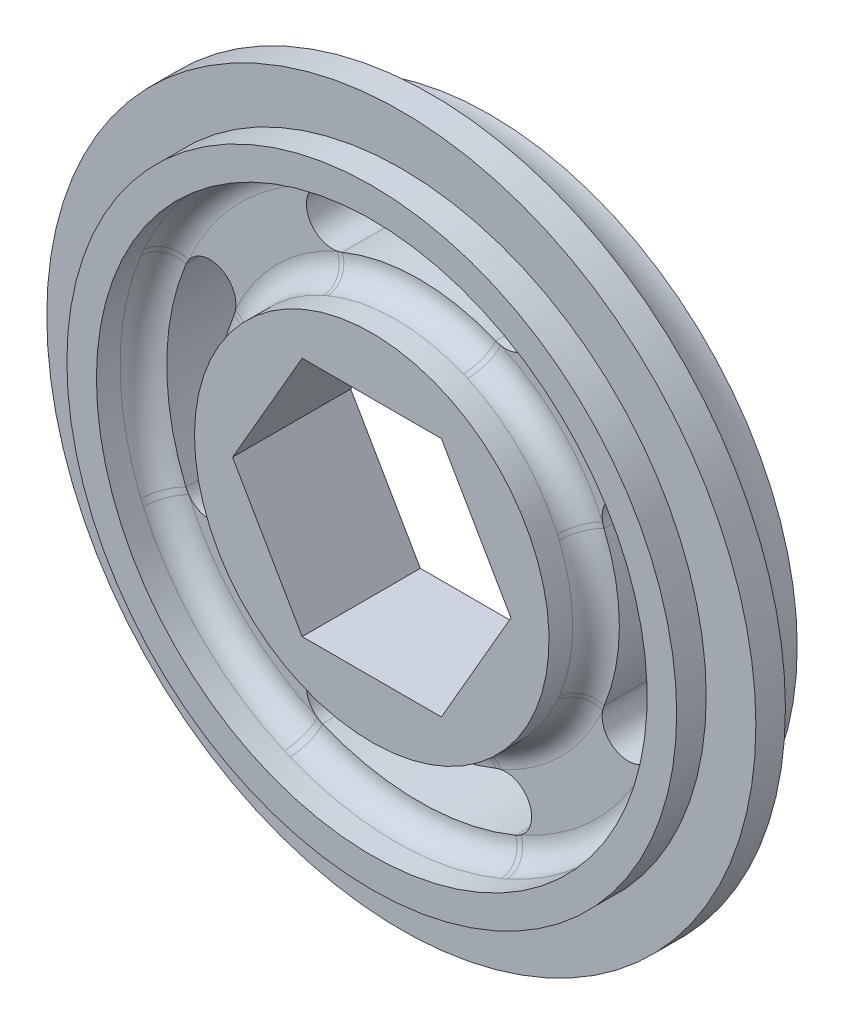
from build123d import *

# Parameters (mm, degrees)
SKETCH1_R                         = 19.05
HEX_AXEL_CUTOUT_OUTSIDE_RIM_DEPTH = 12.7
PIPE_START                        = -1.5875
SKETCH3_R                         = 19.05
SKETCH3_R_2                       = 16.383
PIPE_STEP_DEPTH                   = 1.5875
SKETCH5_R                         = 14.7955
SKETCH5_R_2                       = 9.525
SPOKE_STEP_DEPTH                  = 2.54
SLOTS_DEPTH                       = 29.792891484
FILLET1_R                         = 1.27
SKETCH7_W                         = 50.409195303
SKETCH7_H                         = 73.287011446
MIDCUT_DEPTH                      = 28.679008291


with BuildPart() as part:
    # Sketch1 → Hex Axel Cutout & Outside Rim (new body)
    with BuildSketch(Plane.XY):
        Circle(SKETCH1_R)
        Polygon((-7.478995387, 0), (-3.739497694, -6.477), (3.739497694, -6.477), (7.478995387, 0), (3.739497694, 6.477), (-3.739497694, 6.477), align=None, mode=Mode.SUBTRACT)
    extrude(amount=HEX_AXEL_CUTOUT_OUTSIDE_RIM_DEPTH)

    # Sketch3 → Pipe Step (cut)
    with BuildSketch(Plane.XY.offset(12.7).offset(PIPE_START)):
        Circle(SKETCH3_R)
        Circle(SKETCH3_R_2, mode=Mode.SUBTRACT)
    pipe_step = extrude(amount=PIPE_STEP_DEPTH, mode=Mode.SUBTRACT)

    # Step Mirror: Pipe Step across plane
    add(pipe_step.mirror(Plane.XY.offset(6.35)), mode=Mode.SUBTRACT)

    # Sketch4 → Poly Cord Groove (revolve, cut)
    with BuildSketch(Plane(origin=(0, 0, 0), x_dir=(0, 0, -1), z_dir=(1, 0, 0)), mode=Mode.PRIVATE) as poly_cord_groove_sk:
        with BuildLine():
            Line((-3.175, 19.05), (-9.525, 19.05))
            ThreePointArc((-9.525, 19.05), (-6.35, 16.51), (-3.175, 19.05))
        make_face()
    revolve(poly_cord_groove_sk.sketch.rotate(Axis((0, 0, 11.1125), (0, 0, -1)), 90), axis=Axis((0, 0, 11.1125), (0, 0, -1)), mode=Mode.SUBTRACT)

    # Sketch5 → Spoke Step (cut)
    with BuildSketch(Plane(origin=(0, 0, 0), x_dir=(-1, 0, 0), z_dir=(0, 0, -1))):
        Circle(SKETCH5_R)
        Circle(SKETCH5_R_2, mode=Mode.SUBTRACT)
    spoke_step = extrude(amount=-SPOKE_STEP_DEPTH, mode=Mode.SUBTRACT)

    # Spoke Step Mirror: Spoke Step across plane
    add(spoke_step.mirror(Plane.XY.offset(6.35)), mode=Mode.SUBTRACT)

    # Sketch6 → Slots (cut, through all)
    with BuildSketch(Plane.XY.offset(10.16)):
        with BuildLine():
            ThreePointArc((12.525265792, -5.188134963), (13.55725, 0), (12.525265792, 5.188134963))
            ThreePointArc((12.525265792, 5.188134963), (10.69999733, 5.944185915), (9.943946378, 4.118917453))
            ThreePointArc((9.943946378, 4.118917453), (10.76325, 0), (9.943946378, -4.118917453))
            ThreePointArc((9.943946378, -4.118917453), (10.69999733, -5.944185915), (12.525265792, -5.188134963))
        make_face()
        with BuildLine():
            ThreePointArc((-5.188134963, -12.525265792), (0, -13.55725), (5.188134963, -12.525265792))
            ThreePointArc((5.188134963, -12.525265792), (5.944185915, -10.69999733), (4.118917453, -9.943946378))
            ThreePointArc((4.118917453, -9.943946378), (0, -10.76325), (-4.118917453, -9.943946378))
            ThreePointArc((-4.118917453, -9.943946378), (-5.944185915, -10.69999733), (-5.188134963, -12.525265792))
        make_face()
        with BuildLine():
            ThreePointArc((-12.525265792, 5.188134963), (-13.55725, 0), (-12.525265792, -5.188134963))
            ThreePointArc((-12.525265792, -5.188134963), (-10.69999733, -5.944185915), (-9.943946378, -4.118917453))
            ThreePointArc((-9.943946378, -4.118917453), (-10.76325, 0), (-9.943946378, 4.118917453))
            ThreePointArc((-9.943946378, 4.118917453), (-10.69999733, 5.944185915), (-12.525265792, 5.188134963))
        make_face()
        with BuildLine():
            ThreePointArc((5.188134963, 12.525265792), (0, 13.55725), (-5.188134963, 12.525265792))
            ThreePointArc((-5.188134963, 12.525265792), (-5.944185915, 10.69999733), (-4.118917453, 9.943946378))
            ThreePointArc((-4.118917453, 9.943946378), (0, 10.76325), (4.118917453, 9.943946378))
            ThreePointArc((4.118917453, 9.943946378), (5.944185915, 10.69999733), (5.188134963, 12.525265792))
        make_face()
    extrude(amount=-SLOTS_DEPTH, mode=Mode.SUBTRACT)

    # Fillet1
    # the kernel refuses this fillet: 1.27 mm, written as the material it adds along each edge
    with BuildSketch(Plane(origin=(0, 0, 2.54), x_dir=(-1, 0, 0), z_dir=(0, -1, 0))) as fillet1_piece_1:
        with BuildLine():
            CenterArc((13.5255, 1.269603063), FILLET1_R, 271.432543738, 88.567456262)
            Line((13.55725, 0), (13.557885, -0.025392061))
            ThreePointArc((13.557885, -0.025392061), (14.176375, -0.0254), (14.7955, -0.0254))
            Line((14.7955, -0.0254), (14.8209, 0))
            Line((14.8209, 0), (14.8209, 1.269603063))
            Line((14.8209, 1.269603063), (14.7955, 1.269603063))
        make_face()
    revolve(axis=Axis((0, 0, 2.54), (0, 0, -1)))
    with BuildSketch(Plane(origin=(0, 0, 2.54), x_dir=(-1, 0, 0), z_dir=(0, -1, 0))) as fillet1_piece_2:
        with BuildLine():
            CenterArc((10.795, 1.269603063), FILLET1_R, 180, 88.567456262)
            Line((9.525, 1.269603063), (9.4996, 1.269603063))
            Line((9.4996, 1.269603063), (9.4996, 0))
            Line((9.4996, 0), (9.525, -0.0254))
            ThreePointArc((9.525, -0.0254), (10.144125, -0.0254), (10.762615, -0.025392061))
            Line((10.762615, -0.025392061), (10.76325, 0))
        make_face()
    revolve(axis=Axis((0, 0, 2.54), (0, 0, -1)))
    with BuildSketch(Plane(origin=(0, 0, 10.16), x_dir=(-1, 0, 0), z_dir=(0, -1, 0))) as fillet1_piece_3:
        with BuildLine():
            CenterArc((13.5255, -1.269603063), FILLET1_R, 0, 88.567456262)
            Line((13.55725, 0), (13.557885, 0.025392061))
            ThreePointArc((13.557885, 0.025392061), (14.176375, 0.0254), (14.7955, 0.0254))
            Line((14.7955, 0.0254), (14.8209, 0))
            Line((14.8209, 0), (14.8209, -1.269603063))
            Line((14.8209, -1.269603063), (14.7955, -1.269603063))
        make_face()
    revolve(axis=Axis((0, 0, 10.16), (0, 0, -1)))
    with BuildSketch(Plane(origin=(0, 0, 10.16), x_dir=(-1, 0, 0), z_dir=(0, -1, 0))) as fillet1_piece_4:
        with BuildLine():
            CenterArc((10.795, -1.269603063), FILLET1_R, 91.432543738, 88.567456262)
            Line((9.525, -1.269603063), (9.4996, -1.269603063))
            Line((9.4996, -1.269603063), (9.4996, 0))
            Line((9.4996, 0), (9.525, 0.0254))
            ThreePointArc((9.525, 0.0254), (10.144125, 0.0254), (10.762615, 0.025392061))
            Line((10.762615, 0.025392061), (10.76325, 0))
        make_face()
    revolve(axis=Axis((0, 0, 10.16), (0, 0, -1)))

    # Sketch7 → MidCut (cut, through all)
    with BuildSketch(Plane.XY.offset(6.35)):
        with Locations((-1.207308933, -3.38321392)):
            Rectangle(SKETCH7_W, SKETCH7_H)
    extrude(amount=-MIDCUT_DEPTH, mode=Mode.SUBTRACT)


solid = part.part
